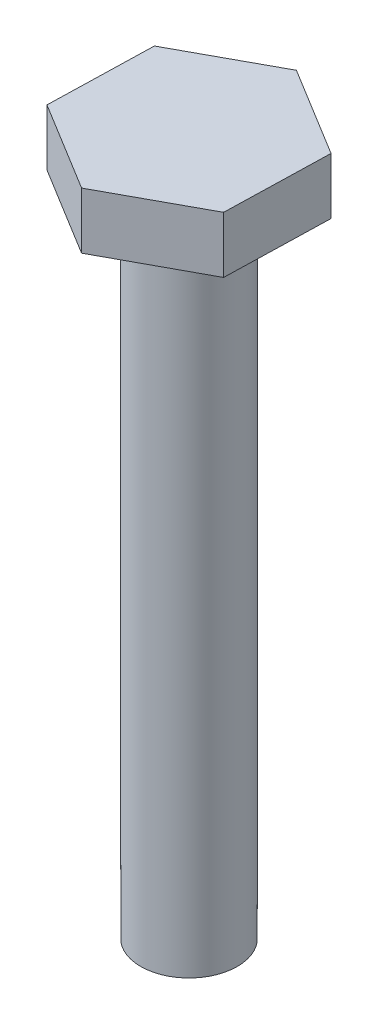
from build123d import *

# Parameters (mm, degrees)
BOSS_EXTRUDE1_DEPTH = 3.5
SKETCH2_R           = 3
BOSS_EXTRUDE2_DEPTH = 40


with BuildPart() as part:
    # Sketch1 → Boss-Extrude1 (new body)
    with BuildSketch(Plane(origin=(0, 0, 0), x_dir=(1, 0, 0), z_dir=(0, 1, 0))):
        Polygon((5.543350936, -3.394298218), (5.711223953, 3.103533624), (0.167873017, 6.497831842), (-5.543350936, 3.394298218), (-5.711223953, -3.103533624), (-0.167873017, -6.497831842), align=None)
    extrude(amount=BOSS_EXTRUDE1_DEPTH)

    # Sketch2 → Boss-Extrude2 (add)
    with BuildSketch(Plane.XZ):
        Circle(SKETCH2_R)
    extrude(amount=BOSS_EXTRUDE2_DEPTH)


solid = part.part
